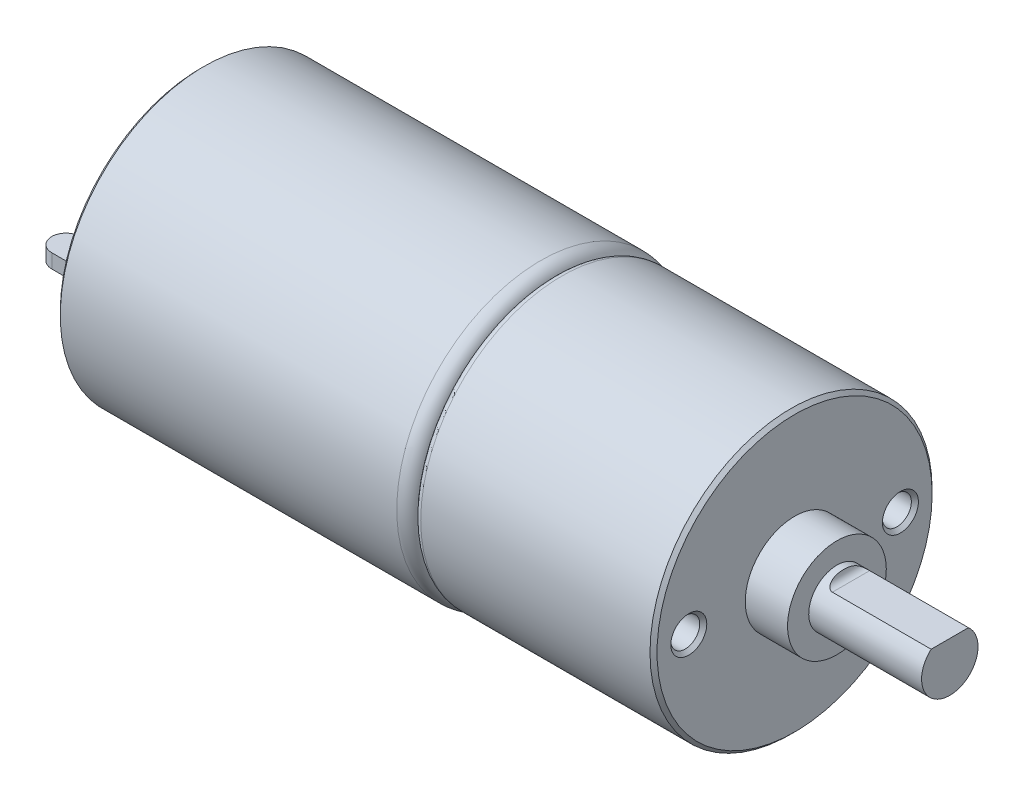
from build123d import *

# Parameters (mm, degrees)
SKETCH1_R                          = 10.2
BOSS_EXTRUDE1_DEPTH                = 25.1
FILLET1_R                          = 1
SKETCH2_R                          = 10
BOSS_EXTRUDE2_DEPTH                = 17
FILLET2_R                          = 0.5
CHAMFER1_SIZE                      = 0.25
SKETCH3_R                          = 3.5
BOSS_EXTRUDE3_DEPTH                = 3
SKETCH4_R                          = 2
BOSS_EXTRUDE4_DEPTH                = 11
CUT_EXTRUDE1_DEPTH                 = 56.024449111
CUT_EXTRUDE1_DEPTH_BACK            = 56.024449111
M2_5X0_45_TAPPED_HOLE1_D           = 2.05
M2_5X0_45_TAPPED_HOLE1_DEPTH       = 5
M2_5X0_45_TAPPED_HOLE1_CSINK_D     = 2.55
M2_5X0_45_TAPPED_HOLE1_CSINK_ANGLE = 90
M2_5X0_45_TAPPED_HOLE1_TIP         = 0.615882135
SKETCH9_W                          = 2
SKETCH9_H                          = 1
BOSS_EXTRUDE5_DEPTH                = 4.4
FILLET3_R                          = 1


with BuildPart() as part:
    # Sketch1 → Boss-Extrude1 (new body)
    with BuildSketch(Plane(origin=(0, 0, 0), x_dir=(0, 0, -1), z_dir=(1, 0, 0))):
        Circle(SKETCH1_R)
    extrude(amount=BOSS_EXTRUDE1_DEPTH)

    # Fillet1
    fillet1_edges = [part.edges().sort_by_distance(p)[0] for p in [
        (25.1, 0, 10.2),
    ]]
    fillet(fillet1_edges, radius=FILLET1_R)

    # Sketch2 → Boss-Extrude2 (add)
    with BuildSketch(Plane(origin=(25.1, 0, 0), x_dir=(0, 0, -1), z_dir=(1, 0, 0))):
        Circle(SKETCH2_R)
    extrude(amount=BOSS_EXTRUDE2_DEPTH)

    # Fillet2
    fillet2_edges = [part.edges().sort_by_distance(p)[0] for p in [
        (25.1, 0, 10),
    ]]
    fillet(fillet2_edges, radius=FILLET2_R)

    # Chamfer1
    chamfer1_edges = [part.edges().sort_by_distance(p)[0] for p in [
        (0, 0, 10.2),
        (42.1, 0, 10),
    ]]
    chamfer(chamfer1_edges, length=CHAMFER1_SIZE)

    # Sketch3 → Boss-Extrude3 (add)
    with BuildSketch(Plane(origin=(42.1, 0, 0), x_dir=(0, 0, -1), z_dir=(1, 0, 0))):
        Circle(SKETCH3_R)
    extrude(amount=BOSS_EXTRUDE3_DEPTH)

    # Sketch4 → Boss-Extrude4 (add)
    with BuildSketch(Plane(origin=(42.1, 0, 0), x_dir=(0, 0, -1), z_dir=(1, 0, 0))):
        Circle(SKETCH4_R)
    extrude(amount=BOSS_EXTRUDE4_DEPTH)

    # Sketch6 → Cut-Extrude1 (cut, two sides: drawn at the far end of the back side and taken through both)
    with BuildSketch(Plane.XY.offset(-CUT_EXTRUDE1_DEPTH_BACK)):
        with BuildLine():
            Line((53.1, 2), (45.6, 2))
            ThreePointArc((45.6, 2), (45.746446609, 1.646446609), (46.1, 1.5))
            Line((46.1, 1.5), (53.1, 1.5))
            Line((53.1, 1.5), (53.1, 2))
        make_face()
    extrude(amount=CUT_EXTRUDE1_DEPTH + CUT_EXTRUDE1_DEPTH_BACK, mode=Mode.SUBTRACT)

    # M2.5x0.45 Tapped Hole1
    with Locations(Plane(origin=(42.1, 0, 0), x_dir=(0, 0, -1), z_dir=(1, 0, 0))):
        with Locations((-7.5, 0), (7.5, 0)):
            CounterSinkHole(M2_5X0_45_TAPPED_HOLE1_D / 2, M2_5X0_45_TAPPED_HOLE1_CSINK_D / 2, depth=M2_5X0_45_TAPPED_HOLE1_DEPTH, counter_sink_angle=M2_5X0_45_TAPPED_HOLE1_CSINK_ANGLE)
            with Locations((0, 0, -(M2_5X0_45_TAPPED_HOLE1_DEPTH + M2_5X0_45_TAPPED_HOLE1_TIP / 2))):  # 118° drill point
                Cone(0, M2_5X0_45_TAPPED_HOLE1_D / 2, M2_5X0_45_TAPPED_HOLE1_TIP, mode=Mode.SUBTRACT)

    # Sketch9 → Boss-Extrude5 (add)
    with BuildSketch(Plane.ZY):
        with Locations((-6.15, 0)):
            Rectangle(SKETCH9_W, SKETCH9_H)
        with Locations((6.15, 0)):
            Rectangle(SKETCH9_W, SKETCH9_H)
    extrude(amount=BOSS_EXTRUDE5_DEPTH)

    # Fillet3
    fillet3_edges = [part.edges().sort_by_distance(p)[0] for p in [
        (-4.4, 0, 7.15),
        (-4.4, 0, 5.15),
        (-4.4, 0, -5.15),
        (-4.4, 0, -7.15),
    ]]
    fillet(fillet3_edges, radius=FILLET3_R - 0.0001)  # a hair under: the kernel refuses the full size


solid = part.part
